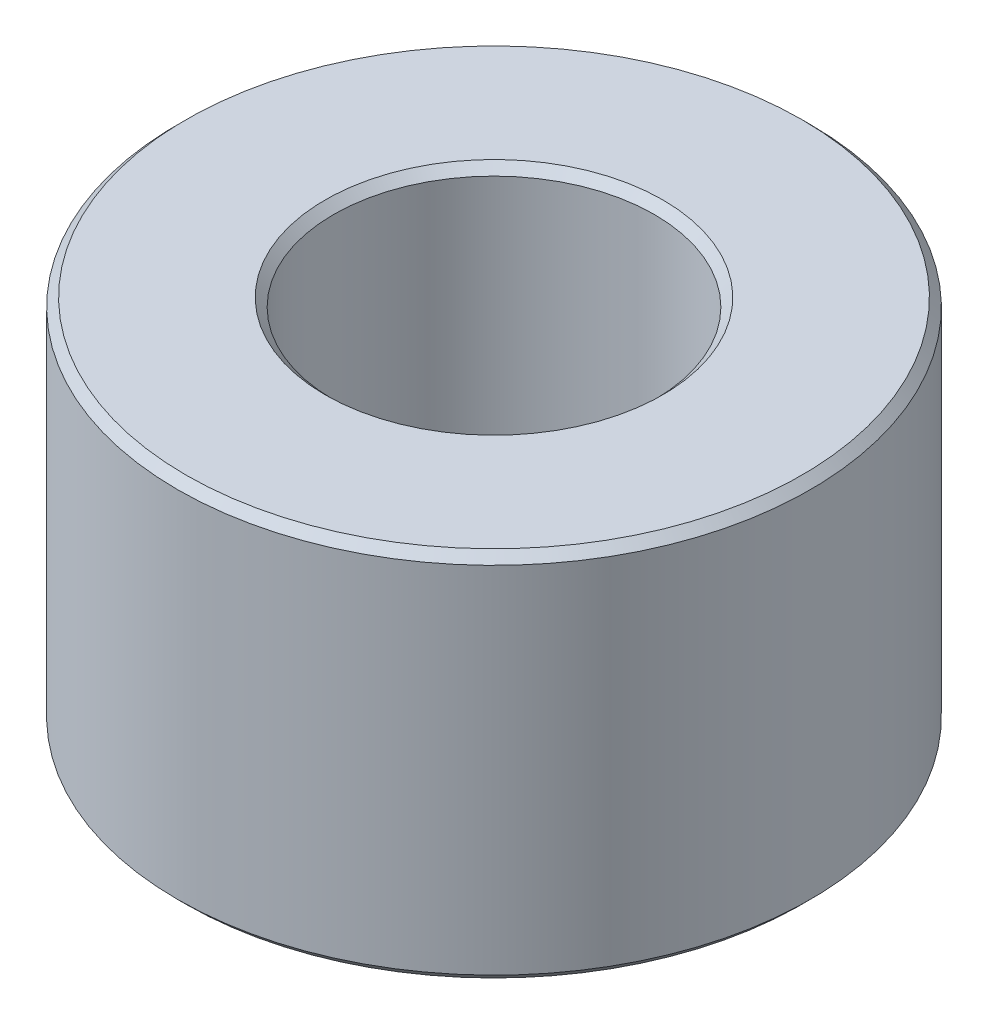
from build123d import *

# Parameters (mm, degrees)
SKETCH1_R           = 32.5
BOSS_EXTRUDE1_DEPTH = 38.192746829
SKETCH2_R           = 16.483563301
CUT_EXTRUDE1_DEPTH  = 60.759400184
CHAMFER1_SIZE       = 0.865475348


with BuildPart() as part:
    # Sketch1 → Boss-Extrude1 (new body)
    with BuildSketch(Plane(origin=(0, 0, 0), x_dir=(1, 0, 0), z_dir=(0, 1, 0))):
        Circle(SKETCH1_R)
    extrude(amount=BOSS_EXTRUDE1_DEPTH)

    # Sketch2 → Cut-Extrude1 (cut, through all)
    with BuildSketch(Plane(origin=(0, 0, 0), x_dir=(1, 0, 0), z_dir=(0, 1, 0))):
        Circle(SKETCH2_R)
    extrude(amount=CUT_EXTRUDE1_DEPTH, mode=Mode.SUBTRACT)

    # Chamfer1
    chamfer1_edges = [part.edges().sort_by_distance(p)[0] for p in [
        (-16.483563301, 38.192746829, 0),
        (-16.483563301, 0, 0),
        (-32.5, 0, 0),
        (-32.5, 38.192746829, 0),
    ]]
    chamfer(chamfer1_edges, length=CHAMFER1_SIZE)


solid = part.part
